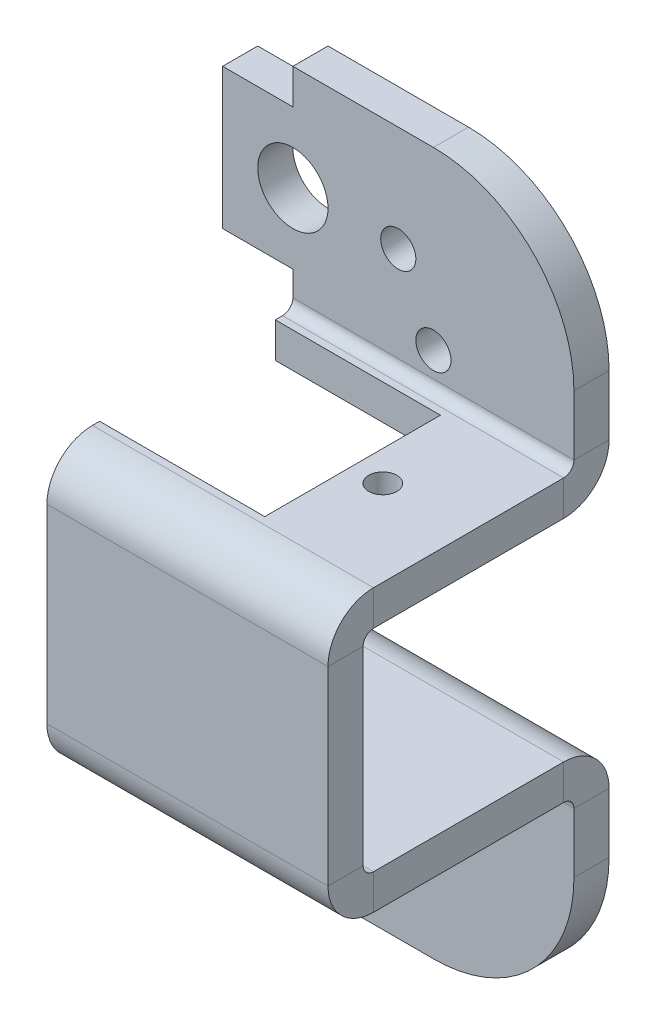
from build123d import *

# Parameters (mm, degrees)
SKETCH1_W           = 40
SKETCH1_H           = 50
SKETCH1_R           = 1.25
BASE_FLANGE1_DEPTH  = 2.5
SKETCH15_R          = 1
CUT_EXTRUDE3_DEPTH  = 10
JOG3_START          = -2.5
JOG3_OUTLINE_W      = 40
JOG3_OUTLINE_H      = 48.294687966
JOG3_OUTLINE_R      = 1
JOG3_OUTLINE_R_2    = 1.25
JOG3_DEPTH          = 2.5
JOG3_2_OUTLINE_W    = 40
JOG3_2_OUTLINE_H    = 1.705312034
JOG3_2_DEPTH        = 0.332528284
JOG3_START_2        = 14.2634
JOG3_3_OUTLINE_W    = 40
JOG3_3_OUTLINE_H    = 35
JOG3_3_OUTLINE_R    = 1
JOG3_3_OUTLINE_R_2  = 1.25
JOG3_3_DEPTH        = 3.2366
JOG3_4_OUTLINE_W    = 40
JOG3_4_OUTLINE_H    = 15.794687966
JOG3_4_OUTLINE_R    = 1.25
JOG3_4_DEPTH        = 3.2366
JOG3_5_OUTLINE_W    = 40
JOG3_5_OUTLINE_H    = 2.5
JOG3_5_DEPTH        = 15
JOG3_START_3        = 15
JOG3_6_OUTLINE_R    = 1.25
JOG3_6_OUTLINE_R_2  = 1
JOG3_6_DEPTH        = 2.5
JOG3_START_4        = -20
JOG3_7_DEPTH        = 40
JOG4_START          = -20
JOG4_DEPTH          = 40
JOG4_2_DEPTH        = 40
JOG4_START_2        = -3
JOG4_3_OUTLINE_R    = 1.25
JOG4_3_DEPTH        = 4
FILLET1_R           = 10
SKETCH18_R          = 2.5
BOSS_EXTRUDE1_DEPTH = 2.5
SKETCH19_R          = 1
SKETCH19_W          = 23.5
SKETCH19_H          = 12.5
CUT_EXTRUDE4_DEPTH  = 2.5
SKETCH20_R          = 2.5
SKETCH20_R_2        = 1.25
CUT_EXTRUDE6_DEPTH  = 10
SKETCH23_R          = 2.5
CUT_EXTRUDE7_DEPTH  = 44.945989578
SKETCH24_R          = 5
CUT_EXTRUDE8_DEPTH  = 1.25
SKETCH25_W          = 20
SKETCH25_H          = 13.5268
CUT_EXTRUDE11_DEPTH = 50.640775238


with BuildPart() as part:
    # Base-Flange1: sheet metal written as solids
    # Sketch1 → Base-Flange1 (new body)
    with BuildSketch(Plane.XY):
        Rectangle(SKETCH1_W, SKETCH1_H)
        with Locations((10, 12.5)):
            Circle(SKETCH1_R, mode=Mode.SUBTRACT)
        with Locations(Location((10, -12.5, 0), (0, 0, 180))):
            Circle(SKETCH1_R, mode=Mode.SUBTRACT)
        with Locations((-10, -12.5)):
            Circle(SKETCH1_R, mode=Mode.SUBTRACT)
        with Locations(Location((-10, 12.5, 0), (0, 0, 180))):
            Circle(SKETCH1_R, mode=Mode.SUBTRACT)
    extrude(amount=-BASE_FLANGE1_DEPTH)

    # Sketch15 → Cut-Extrude3 (cut)
    with BuildSketch(Plane.XY):
        with Locations((12, 0)):
            Circle(SKETCH15_R)
        with Locations(Location((-17, 0, 0), (0, 0, 180))):
            Circle(SKETCH15_R)
    extrude(amount=-CUT_EXTRUDE3_DEPTH, mode=Mode.SUBTRACT)

    # Jog3: read off the stored shape, not the designer's step
    # Jog3 outline → Jog3 (cut)
    with BuildSketch(Plane.XY.offset(JOG3_START)):
        with Locations((0, -0.852656017)):
            Rectangle(JOG3_OUTLINE_W, JOG3_OUTLINE_H)
        with Locations((-17, 0)):
            Circle(JOG3_OUTLINE_R, mode=Mode.SUBTRACT)
        with Locations((12, 0)):
            Circle(JOG3_OUTLINE_R, mode=Mode.SUBTRACT)
        with Locations((-10, 12.5)):
            Circle(JOG3_OUTLINE_R_2, mode=Mode.SUBTRACT)
        with Locations((10, 12.5)):
            Circle(JOG3_OUTLINE_R_2, mode=Mode.SUBTRACT)
        with Locations((10, -12.5)):
            Circle(JOG3_OUTLINE_R_2, mode=Mode.SUBTRACT)
        with Locations((-10, -12.5)):
            Circle(JOG3_OUTLINE_R_2, mode=Mode.SUBTRACT)
    extrude(amount=JOG3_DEPTH, mode=Mode.SUBTRACT)

    # Jog3 2 outline → Jog3 2 (cut)
    with BuildSketch(Plane.XY.offset(JOG3_START)):
        with Locations((0, 24.147343983)):
            Rectangle(JOG3_2_OUTLINE_W, JOG3_2_OUTLINE_H)
    extrude(amount=JOG3_2_DEPTH, mode=Mode.SUBTRACT)

    # Jog3 4 outline → Jog3 4 (add)
    with BuildSketch(Plane.XY.offset(JOG3_START)):
        with Locations((0, 32.897343983)):
            Rectangle(JOG3_4_OUTLINE_W, JOG3_4_OUTLINE_H)
        with Locations((10, 28.294687966)):
            Circle(JOG3_4_OUTLINE_R, mode=Mode.SUBTRACT)
        with Locations((-10, 28.294687966)):
            Circle(JOG3_4_OUTLINE_R, mode=Mode.SUBTRACT)
    extrude(amount=JOG3_4_DEPTH)



with BuildPart() as body_2:
    # Jog3 3 outline → Jog3 3 (new body)
    with BuildSketch(Plane.XY.offset(JOG3_START_2)):
        with Locations((0, 8.294687966)):
            Rectangle(JOG3_3_OUTLINE_W, JOG3_3_OUTLINE_H)
        with Locations((12, 15.794687966)):
            Circle(JOG3_3_OUTLINE_R, mode=Mode.SUBTRACT)
        with Locations((-17, 0)):
            Circle(JOG3_3_OUTLINE_R, mode=Mode.SUBTRACT)
        with Locations((-10, 3.294687966)):
            Circle(JOG3_3_OUTLINE_R_2, mode=Mode.SUBTRACT)
        with Locations((12, 0)):
            Circle(JOG3_3_OUTLINE_R, mode=Mode.SUBTRACT)
        with Locations((10, 3.294687966)):
            Circle(JOG3_3_OUTLINE_R_2, mode=Mode.SUBTRACT)
        with Locations((-17, 15.794687966)):
            Circle(JOG3_3_OUTLINE_R, mode=Mode.SUBTRACT)
        with Locations((-10, 12.5)):
            Circle(JOG3_3_OUTLINE_R_2, mode=Mode.SUBTRACT)
        with Locations((10, 12.5)):
            Circle(JOG3_3_OUTLINE_R_2, mode=Mode.SUBTRACT)
    extrude(amount=JOG3_3_DEPTH)


with BuildPart() as part_1:
    add(part.part)

    add(body_2.part)  # Jog3 5 merges body 2
    # Jog3 5 outline → Jog3 5 (add)
    with BuildSketch(Plane.XY):
        with Locations((0, 24.544687966)):
            Rectangle(JOG3_5_OUTLINE_W, JOG3_5_OUTLINE_H)
    extrude(amount=JOG3_5_DEPTH)

    # Jog3 6 outline → Jog3 6 (add)
    with BuildSketch(Plane.XY.offset(JOG3_START_3)):
        with Locations((10, 12.5)):
            Circle(JOG3_6_OUTLINE_R)
        with Locations((-10, 12.5)):
            Circle(JOG3_6_OUTLINE_R)
        with Locations((12, 0)):
            Circle(JOG3_6_OUTLINE_R_2)
        with Locations((-17, 0)):
            Circle(JOG3_6_OUTLINE_R_2)
    extrude(amount=JOG3_6_DEPTH)

    # Jog3 7 outline → Jog3 7 (cut)
    with BuildSketch(Plane.YZ.offset(JOG3_START_4)):
        with BuildLine():
            ThreePointArc((23.294687966, 14.2634), (23.078942821, 14.784254855), (22.558087966, 15))
            Line((22.558087966, 15), (-9.205312034, 15))
            Line((-9.205312034, 15), (-9.205312034, 14.2634))
            Line((-9.205312034, 14.2634), (23.294687966, 14.2634))
        make_face()
        with BuildLine():
            ThreePointArc((26.531287966, -2.5), (24.242666158, -1.552021808), (23.294687966, 0.7366))
            Line((23.294687966, 0.7366), (23.294687966, -2.167471716))
            Line((23.294687966, -2.167471716), (25, -2.167471716))
            Line((25, -2.167471716), (25, -2.5))
            Line((25, -2.5), (26.531287966, -2.5))
        make_face()
        with BuildLine():
            Line((26.531287966, 0), (40.794687966, 0))
            Line((40.794687966, 0), (40.794687966, 0.7366))
            Line((40.794687966, 0.7366), (25.794687966, 0.7366))
            ThreePointArc((25.794687966, 0.7366), (26.010433111, 0.215745145), (26.531287966, 0))
        make_face()
        with BuildLine():
            Line((25.794687966, 17.5), (22.558087966, 17.5))
            ThreePointArc((22.558087966, 17.5), (24.846709774, 16.552021808), (25.794687966, 14.2634))
            Line((25.794687966, 14.2634), (25.794687966, 17.5))
        make_face()
    extrude(amount=JOG3_7_DEPTH, mode=Mode.SUBTRACT)

    # Jog4: read off the stored shape, not the designer's step
    # Jog4 outline → Jog4 (cut)
    with BuildSketch(Plane.YZ.offset(JOG4_START)):
        with BuildLine():
            Line((-9.205312034, 15), (5.87962174, 15))
            ThreePointArc((5.87962174, 15), (7.019882984, 16.799110859), (9.031287966, 17.5))
            Line((9.031287966, 17.5), (-9.205312034, 17.5))
            Line((-9.205312034, 17.5), (-9.205312034, 15))
        make_face()
    extrude(amount=JOG4_DEPTH, mode=Mode.SUBTRACT)

    # Jog4 2 outline → Jog4 2 (add)
    with BuildSketch(Plane.YZ.offset(JOG4_START)):
        with BuildLine():
            Line((-9.205312034, 0), (-9.205312034, -2.5))
            Line((-9.205312034, -2.5), (5.058087966, -2.5))
            ThreePointArc((5.058087966, -2.5), (7.346709774, -1.552021808), (8.294687966, 0.7366))
            Line((8.294687966, 0.7366), (8.294687966, 14.2634))
            ThreePointArc((8.294687966, 14.2634), (8.510433111, 14.784254855), (9.031287966, 15))
            Line((9.031287966, 15), (5.87962174, 15))
            ThreePointArc((5.87962174, 15), (5.81599152, 14.634140241), (5.794687966, 14.2634))
            Line((5.794687966, 14.2634), (5.794687966, 0.7366))
            ThreePointArc((5.794687966, 0.7366), (5.578942821, 0.215745145), (5.058087966, 0))
            Line((5.058087966, 0), (-9.205312034, 0))
        make_face()
    extrude(amount=JOG4_2_DEPTH)

    # Jog4 3 outline → Jog4 3 (cut)
    with BuildSketch(Plane.XY.offset(JOG4_START_2)):
        with Locations((-10, 3.294687966)):
            Circle(JOG4_3_OUTLINE_R)
        with Locations((10, 3.294687966)):
            Circle(JOG4_3_OUTLINE_R)
    extrude(amount=JOG4_3_DEPTH, mode=Mode.SUBTRACT)

    # Fillet1
    fillet1_edges = [part_1.edges().sort_by_distance(p)[0] for p in [
        (20, -9.205312034, -1.25),
        (-20, -9.205312034, -1.25),
        (-20, 40.794687966, -1.25),
        (20, 40.794687966, -1.25),
    ]]
    fillet(fillet1_edges, radius=FILLET1_R)

    # Sketch18 → Boss-Extrude1 (add)
    with BuildSketch(Plane.XY.offset(17.5)):
        with Locations((12, 15.794687966)):
            Circle(SKETCH18_R)
        with Locations((-17, 15.794687966)):
            Circle(SKETCH18_R)
    extrude(amount=-BOSS_EXTRUDE1_DEPTH)

    # Sketch19 → Cut-Extrude4 (cut)
    with BuildSketch(Plane(origin=(0, 25.794687966, 0), x_dir=(1, 0, 0), z_dir=(0, 1, 0))):
        with Locations(Location((13.9, -7.5, 0), (0, 0, 270))):
            Circle(SKETCH19_R)
        with Locations(Location((-13.9, -7.5, 0), (0, 0, 90))):
            Circle(SKETCH19_R)
        with Locations((0, -7.5)):
            Rectangle(SKETCH19_W, SKETCH19_H)
    extrude(amount=-CUT_EXTRUDE4_DEPTH, mode=Mode.SUBTRACT)

    # Sketch20 → Cut-Extrude6 (cut)
    with BuildSketch(Plane.XY):
        with Locations((0, 33.294687966)):
            Circle(SKETCH20_R)
        with Locations(Location((0, -1.705312034, 0), (0, 0, 180))):
            Circle(SKETCH20_R)
        with Locations((7.5, -1.705312034)):
            Circle(SKETCH20_R_2)
        with Locations(Location((-7.5, -1.705312034, 0), (0, 0, 180))):
            Circle(SKETCH20_R_2)
        with Locations(Location((7.5, 33.294687966, 0), (0, 0, 180))):
            Circle(SKETCH20_R_2)
        with Locations((-7.5, 33.294687966)):
            Circle(SKETCH20_R_2)
    extrude(amount=-CUT_EXTRUDE6_DEPTH, mode=Mode.SUBTRACT)

    # Sketch23 → Cut-Extrude7 (cut, through all)
    with BuildSketch(Plane(origin=(0, 25.794687966, 0), x_dir=(1, 0, 0), z_dir=(0, 1, 0))):
        with Locations(Location((-5.55, -7.5, 0), (0, 0, 270))):
            Circle(SKETCH23_R)
    extrude(amount=-CUT_EXTRUDE7_DEPTH, mode=Mode.SUBTRACT)

    # Sketch24 → Cut-Extrude8 (cut)
    with BuildSketch(Plane(origin=(0, 8.294687966, 0), x_dir=(1, 0, 0), z_dir=(0, 1, 0))):
        with Locations(Location((-5.55, -7.5, 0), (0, 0, 270))):
            Circle(SKETCH24_R)
    extrude(amount=-CUT_EXTRUDE8_DEPTH, mode=Mode.SUBTRACT)

    # Sketch25 → Cut-Extrude11 (cut, through all)
    with BuildSketch(Plane.XY.offset(17.5)):
        Polygon((0, 38.294687966), (0, 40.794687966), (-20, 40.794687966), (-20, 22.558087966), (0, 22.558087966), (0, 28.294687966), (-5, 28.294687966), (-5, 38.294687966), align=None)
        with Locations((-10, 15.794687966)):
            Rectangle(SKETCH25_W, SKETCH25_H)
        Polygon((0, 9.031287966), (-20, 9.031287966), (-20, -9.205312034), (0, -9.205312034), (0, -6.705312034), (5, -6.705312034), (5, 3.294687966), (0, 3.294687966), align=None)
    extrude(amount=-CUT_EXTRUDE11_DEPTH, mode=Mode.SUBTRACT)


solid = part_1.part
